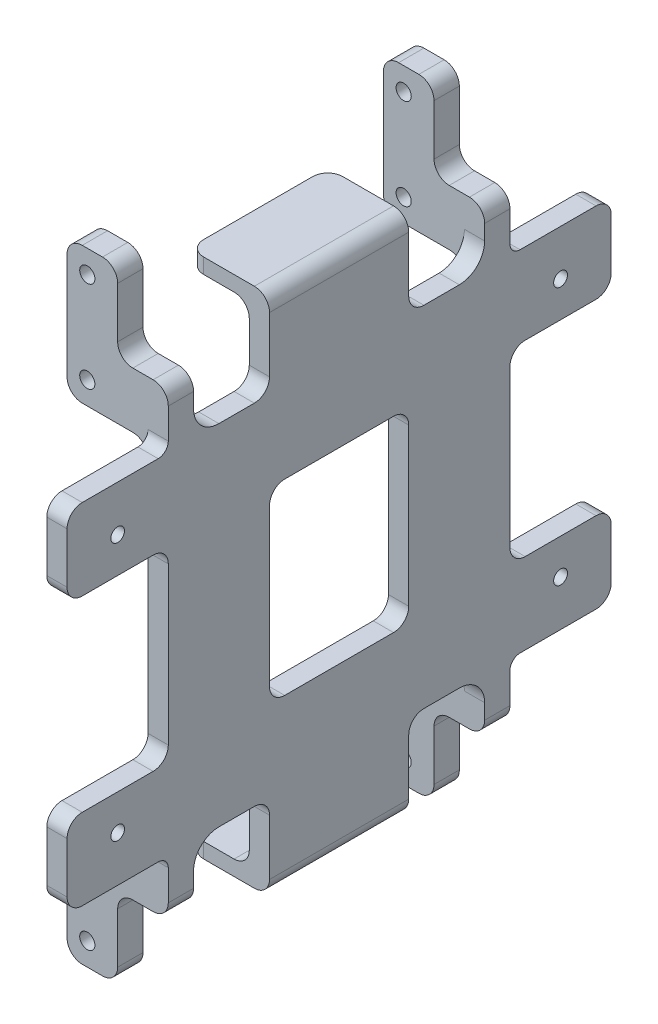
from build123d import *

# Parameters (mm, degrees)
BOSS_EXTRUDE4_DEPTH = 4
BOSS_EXTRUDE5_DEPTH = 5
FILLET5_R           = 5
FILLET6_R           = 2
FILLET7_R           = 3
SKETCH11_R          = 1.5
CUT_EXTRUDE6_DEPTH  = 104.181370521
SKETCH12_R          = 1.368026344
SKETCH12_R_2        = 1.35
CUT_EXTRUDE7_DEPTH  = 5
FILLET8_R           = 3
SKETCH13_W          = 27.5
SKETCH13_H          = 3
BOSS_EXTRUDE6_DEPTH = 12
FILLET9_R           = 3
SKETCH14_W          = 20
SKETCH14_H          = 18.5
BOSS_EXTRUDE7_DEPTH = 4
FILLET10_R          = 3


with BuildPart() as part:
    # Sketch9 → Boss-Extrude4 (new body)
    with BuildSketch(Plane.ZY.offset(-47.264100781)):
        Polygon((-107.5, -0.5), (-67.5, -0.5), (-67.5, -17.5), (-40, -17.5), (-40, -0.5), (0, -0.5), (0, 15.5), (-107.5, 15.5), align=None)
    extrude(amount=BOSS_EXTRUDE4_DEPTH)

    # Sketch10 → Boss-Extrude5 (add)
    with BuildSketch(Plane(origin=(0, 0, -20), x_dir=(-1, 0, 0), z_dir=(0, 0, -1))):
        Polygon((-43.264100781, -0.5), (-27.264100781, -0.5), (-27.264100781, -27.5), (-37.264100781, -27.5), (-37.264100781, -11.5), (-47.264100781, -11.5), (-47.264100781, 7.5), (-43.264100781, 7.5), align=None)
    boss_extrude5 = extrude(amount=BOSS_EXTRUDE5_DEPTH)

    # Mirror1: Boss-Extrude5 across plane
    add(boss_extrude5.mirror(Plane.XY.offset(-53.75)))

    # Fillet5
    fillet5_edges = [part.edges().sort_by_distance(p)[0] for p in [
        (45.264100781, -0.5, -82.5),
        (45.264100781, -0.5, -25),
    ]]
    fillet(fillet5_edges, radius=FILLET5_R)

    # Fillet6
    fillet6_edges = [part.edges().sort_by_distance(p)[0] for p in [
        (45.264100781, -0.5, -87.5),
        (45.264100781, -0.5, -20),
    ]]
    fillet(fillet6_edges, radius=FILLET6_R)

    # Fillet7
    fillet7_edges = [part.edges().sort_by_distance(p)[0] for p in [
        (43.264100781, -0.5, -85),
        (37.264100781, -11.5, -85),
        (37.264100781, -11.5, -22.5),
        (43.264100781, -0.5, -22.5),
    ]]
    fillet(fillet7_edges, radius=FILLET7_R)
    fillet7_2_edges = [part.edges().sort_by_distance(p)[0] for p in [
        (45.264100781, 15.5, -107.5),
        (45.264100781, -0.5, -107.5),
        (45.264100781, 15.5, 0),
        (47.264100781, -11.5, -85),
        (27.264100781, -0.5, -85),
        (37.264100781, -27.5, -85),
        (27.264100781, -27.5, -85),
        (47.264100781, -11.5, -22.5),
        (27.264100781, -0.5, -22.5),
        (37.264100781, -27.5, -22.5),
        (27.264100781, -27.5, -22.5),
        (45.264100781, -0.5, 0),
    ]]
    fillet(fillet7_2_edges, radius=FILLET7_R)

    # Sketch11 → Cut-Extrude6 (cut, through all)
    with BuildSketch(Plane(origin=(0, 0, -87.5), x_dir=(-1, 0, 0), z_dir=(0, 0, -1))):
        with Locations((-31.264100781, -5)):
            Circle(SKETCH11_R)
        with Locations((-31.264100781, -23)):
            Circle(SKETCH11_R)
    extrude(amount=-CUT_EXTRUDE6_DEPTH, mode=Mode.SUBTRACT)

    # Sketch12 → Cut-Extrude7 (cut)
    with BuildSketch(Plane.ZY.offset(-43.264100781)):
        with Locations((-97.5, 8.5)):
            Circle(SKETCH12_R)
        with Locations((-10, 8.5)):
            Circle(SKETCH12_R_2)
    extrude(amount=-CUT_EXTRUDE7_DEPTH, mode=Mode.SUBTRACT)

    # Fillet8
    fillet8_edges = [part.edges().sort_by_distance(p)[0] for p in [
        (45.264100781, -0.5, -67.5),
        (45.264100781, -0.5, -40),
    ]]
    fillet(fillet8_edges, radius=FILLET8_R)

    # Sketch13 → Boss-Extrude6 (add)
    with BuildSketch(Plane.ZY.offset(-43.264100781)):
        with Locations((-53.75, -16)):
            Rectangle(SKETCH13_W, SKETCH13_H)
    extrude(amount=BOSS_EXTRUDE6_DEPTH)

    # Fillet9
    fillet9_edges = [part.edges().sort_by_distance(p)[0] for p in [
        (31.264100781, -16, -40),
        (31.264100781, -16, -67.5),
        (43.264100781, -14.5, -53.75),
        (47.264100781, -17.5, -53.75),
    ]]
    fillet(fillet9_edges, radius=FILLET9_R)

    # Sketch14 → Boss-Extrude7 (add)
    with BuildSketch(Plane.ZY.offset(-47.264100781)):
        with Locations((-30, 24.75)):
            Rectangle(SKETCH14_W, SKETCH14_H)
        with Locations((-77.5, 24.75)):
            Rectangle(SKETCH14_W, SKETCH14_H)
    extrude(amount=BOSS_EXTRUDE7_DEPTH)

    # Fillet10
    fillet10_edges = [part.edges().sort_by_distance(p)[0] for p in [
        (45.264100781, 15.5, -20),
        (45.264100781, 15.5, -40),
        (45.264100781, 15.5, -67.5),
        (45.264100781, 15.5, -87.5),
    ]]
    fillet(fillet10_edges, radius=FILLET10_R)

    # Mirror2: part across plane


with BuildPart() as part_1:
    add(part.part)
    add(part.part.mirror(Plane(origin=(43.264100781, 34, -20), x_dir=(0, 0, 1), z_dir=(0, -1, 0))))


solid = part_1.part
